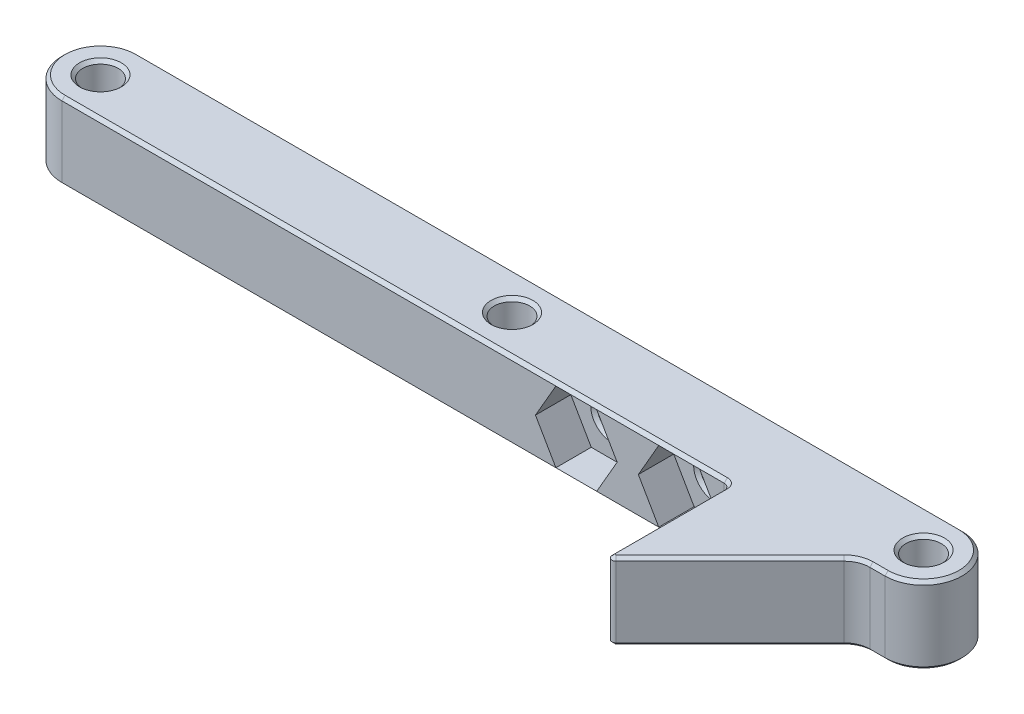
from build123d import *

# Parameters (mm, degrees)
SKETCH1_R               = 2.1828125
BOSS_EXTRUDE1_DEPTH     = 9.525
CUT_EXTRUDE2_DEPTH      = 4.365625
CUT_EXTRUDE3_DEPTH      = 109.557926934
CUT_EXTRUDE3_DEPTH_BACK = 109.557926934
SKETCH6_R               = 2.1828125
CHAMFER1_SIZE           = 0.396875


with BuildPart() as part:
    # Sketch1 → Boss-Extrude1 (new body)
    with BuildSketch(Plane(origin=(0, 0, 0), x_dir=(1, 0, 0), z_dir=(0, 1, 0))):
        with BuildLine():
            Line((0, -4.7625), (-1.859871939, -4.7625))
            ThreePointArc((-1.859871939, -4.7625), (-3.074891837, -5.004182484), (-4.10493597, -5.69243597))
            Line((-4.10493597, -5.69243597), (-18.182789755, -19.770289755))
            ThreePointArc((-18.182789755, -19.770289755), (-18.736403184, -19.880410313), (-19.05, -19.41107951))
            Line((-19.05, -19.41107951), (-19.05, -5.55625))
            ThreePointArc((-19.05, -5.55625), (-19.282483992, -4.994983992), (-19.84375, -4.7625))
            Line((-19.84375, -4.7625), (-101.6, -4.7625))
            ThreePointArc((-101.6, -4.7625), (-106.3625, 0), (-101.6, 4.7625))
            Line((-101.6, 4.7625), (0, 4.7625))
            ThreePointArc((0, 4.7625), (4.7625, 0), (0, -4.7625))
        make_face()
        with Locations(Location((0, 0, 0), (0, 0, 90))):
            Circle(SKETCH1_R, mode=Mode.SUBTRACT)
        with Locations(Location((-50.8, 0, 0), (0, 0, 90))):
            Circle(SKETCH1_R, mode=Mode.SUBTRACT)
        with Locations(Location((-101.6, 0, 0), (0, 0, 90))):
            Circle(SKETCH1_R, mode=Mode.SUBTRACT)
    extrude(amount=BOSS_EXTRUDE1_DEPTH)

    # Sketch5 → Cut-Extrude2 (cut)
    with BuildSketch(Plane.XY.offset(4.7625)):
        Polygon((-20.359010462, 4.7625), (-22.879505231, 9.128125), (-27.920494769, 9.128125), (-30.440989538, 4.7625), (-27.920494769, 0.396875), (-22.879505231, 0.396875), align=None)
        Polygon((-33.059010462, 4.7625), (-35.579505231, 9.128125), (-40.620494769, 9.128125), (-43.140989538, 4.7625), (-40.620494769, 0.396875), (-35.579505231, 0.396875), align=None)
    extrude(amount=-CUT_EXTRUDE2_DEPTH, mode=Mode.SUBTRACT)

    # Sketch6 → Cut-Extrude3 (cut, two sides: drawn at the far end of the back side and taken through both)
    with BuildSketch(Plane.XY.offset(0.396875).offset(-CUT_EXTRUDE3_DEPTH_BACK)):
        with Locations((-38.1, 4.7625)):
            Circle(SKETCH6_R)
        with Locations((-25.4, 4.7625)):
            Circle(SKETCH6_R)
    extrude(amount=CUT_EXTRUDE3_DEPTH + CUT_EXTRUDE3_DEPTH_BACK, mode=Mode.SUBTRACT)

    # Chamfer1
    chamfer1_edges = [part.edges().sort_by_distance(p)[0] for p in [
        (-0.92993597, 0, 4.7625),
        (-3.074891837, 0, 5.004182484),
        (-11.143862862, 0, 12.731362862),
        (-18.736403184, 0, 19.880410313),
        (-19.05, 0, 12.483664755),
        (-19.282483992, 0, 4.994983992),
        (-60.721875, 0, 4.7625),
        (-106.3625, 9.525, 0),
        (-106.3625, 0, 0),
        (-50.8, 0, -4.7625),
        (4.7625, 0, 0),
        (-60.721875, 9.525, 4.7625),
        (-19.282483992, 9.525, 4.994983992),
        (-19.05, 9.525, 12.483664755),
        (0, 0, 2.1828125),
        (0, 9.525, 2.1828125),
        (-18.736403184, 9.525, 19.880410313),
        (-50.8, 0, 2.1828125),
        (-50.8, 9.525, 2.1828125),
        (-11.143862862, 9.525, 12.731362862),
        (-101.6, 0, 2.1828125),
        (-101.6, 9.525, 2.1828125),
        (-3.074891837, 9.525, 5.004182484),
        (-0.92993597, 9.525, 4.7625),
        (4.7625, 9.525, 0),
        (-40.2828125, 4.7625, 0.396875),
        (-40.2828125, 4.7625, -4.7625),
        (-27.5828125, 4.7625, 0.396875),
        (-27.5828125, 4.7625, -4.7625),
        (-50.8, 9.525, -4.7625),
    ]]
    chamfer(chamfer1_edges, length=CHAMFER1_SIZE - 0.0001)  # a hair under: the kernel refuses the full size


solid = part.part
